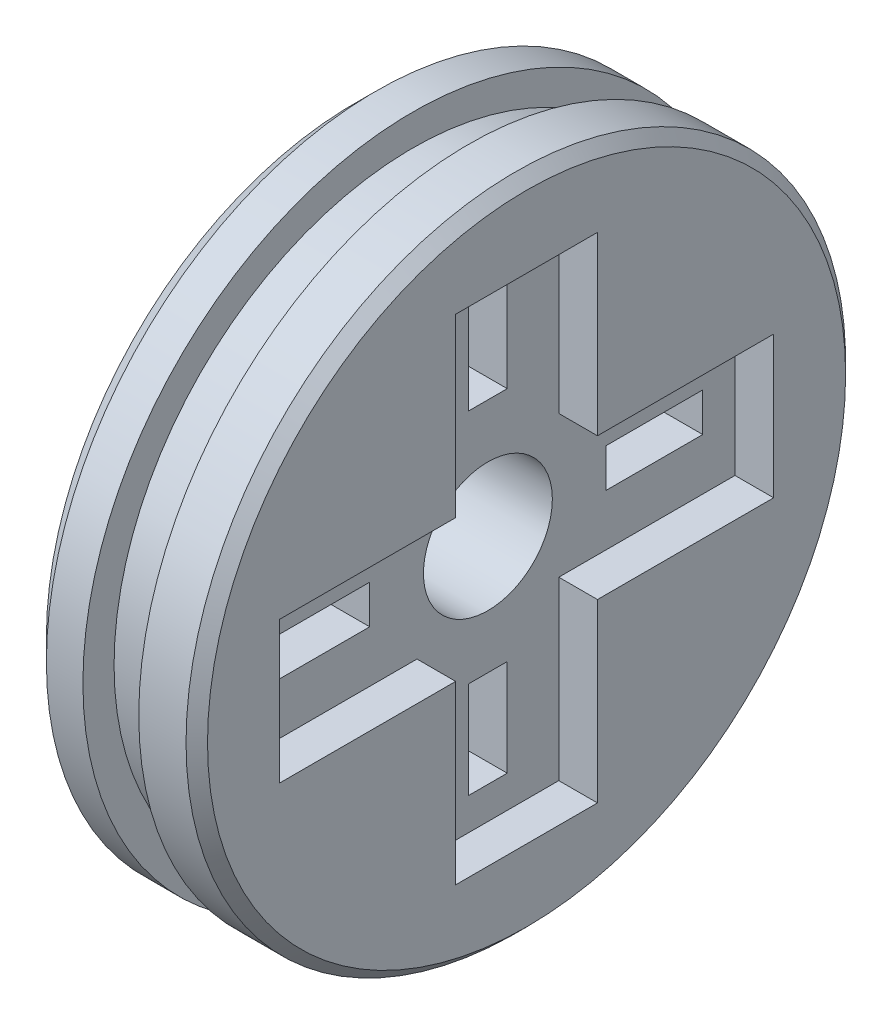
from build123d import *

# Parameters (mm, degrees)
SKETCH2_W            = 2.6
SKETCH2_H            = 2.45
BOSS_EXTRUDE1_START  = 62.7
SKETCH3_W            = 2.3
SKETCH3_H            = 23
BOSS_EXTRUDE1_DEPTH  = 6.6
BOSS_EXTRUDE2_START  = 54.5
SKETCH4_W            = 2.3
SKETCH4_H            = 6.6
BOSS_EXTRUDE2_DEPTH  = 23
BOSS_EXTRUDE3_START  = -79
SKETCH5_R            = 4.6
BOSS_EXTRUDE3_DEPTH  = 2.3
BOSS_EXTRUDE4_START  = -85.7
SKETCH6_R            = 7.1
BOSS_EXTRUDE4_DEPTH  = 1.7
BOSS_EXTRUDE5_START  = -84.1
SKETCH7_R            = 3
BOSS_EXTRUDE5_DEPTH  = 5.2
BOSS_EXTRUDE6_START  = 65.1
SKETCH8_W            = 4.1
SKETCH8_H            = 2.1
BOSS_EXTRUDE6_DEPTH  = 1.8
BOSS_EXTRUDE7_START  = 71.5
SKETCH9_W            = 4.1
SKETCH9_H            = 1.8
BOSS_EXTRUDE7_DEPTH  = 2.1
BOSS_EXTRUDE8_START  = 65.1
SKETCH10_W           = 4.1
SKETCH10_H           = 2.1
BOSS_EXTRUDE8_DEPTH  = 1.8
BOSS_EXTRUDE9_START  = 58.4
SKETCH11_W           = 4.1
SKETCH11_H           = 1.8
BOSS_EXTRUDE9_DEPTH  = 2.1
BOSS_EXTRUDE10_START = 65.1
SKETCH12_W           = 5.3
SKETCH12_H           = 2.4
BOSS_EXTRUDE10_DEPTH = 1.8
BOSS_EXTRUDE11_START = 73.6
SKETCH13_W           = 5.3
SKETCH13_H           = 1.8
BOSS_EXTRUDE11_DEPTH = 2.4
BOSS_EXTRUDE12_START = 65.1
SKETCH14_W           = 5.3
SKETCH14_H           = 2.4
BOSS_EXTRUDE12_DEPTH = 1.8
BOSS_EXTRUDE13_START = 56
SKETCH15_W           = 5.3
SKETCH15_H           = 1.8
BOSS_EXTRUDE13_DEPTH = 2.4


with BuildPart() as part:
    # Sketch1 → Revolve1 (revolve)
    with BuildSketch(Plane.XY.offset(66)):
        Polygon((-77.2, -65), (-85.2, -65), (-85.2, -50.65), (-84.2, -49.65), (-77.7, -49.65), (-77.2, -50.15), align=None)
    revolve(axis=Axis((-90.2, -65, 66), (1, 0, 0)))


with BuildPart() as body_2:
    # Sketch2 → Revolve2 (revolve)
    with BuildSketch(Plane.XY.offset(66)):
        with Locations((-81.2, -49.875)):
            Rectangle(SKETCH2_W, SKETCH2_H)
    revolve(axis=Axis((-87.5, -65, 66), (1, 0, 0)))


with BuildPart() as part_1:
    add(part.part)

    # Combine1: cut body 2
    add(body_2.part, mode=Mode.SUBTRACT)


with BuildPart() as body_2_2:
    # Sketch3 → Boss-Extrude1 (new body)
    with BuildSketch(Plane.XY.offset(BOSS_EXTRUDE1_START)):
        with Locations((-77.85, -65)):
            Rectangle(SKETCH3_W, SKETCH3_H)
    extrude(amount=BOSS_EXTRUDE1_DEPTH)


with BuildPart() as part_2:
    add(part_1.part)

    # Combine2: cut body 2 2
    add(body_2_2.part, mode=Mode.SUBTRACT)


with BuildPart() as body_2_3:
    # Sketch4 → Boss-Extrude2 (new body)
    with BuildSketch(Plane.XY.offset(BOSS_EXTRUDE2_START)):
        with Locations((-77.85, -65)):
            Rectangle(SKETCH4_W, SKETCH4_H)
    extrude(amount=BOSS_EXTRUDE2_DEPTH)


with BuildPart() as part_3:
    add(part_2.part)

    # Combine3: cut body 2 3
    add(body_2_3.part, mode=Mode.SUBTRACT)


with BuildPart() as body_2_4:
    # Sketch5 → Boss-Extrude3 (new body)
    with BuildSketch(Plane(origin=(0, 0, 0), x_dir=(0, 0, -1), z_dir=(1, 0, 0)).offset(BOSS_EXTRUDE3_START)):
        with Locations((-66, -65)):
            Circle(SKETCH5_R)
    extrude(amount=BOSS_EXTRUDE3_DEPTH)


with BuildPart() as part_4:
    add(part_3.part)

    # Combine4: cut body 2 4
    add(body_2_4.part, mode=Mode.SUBTRACT)


with BuildPart() as body_2_5:
    # Sketch6 → Boss-Extrude4 (new body)
    with BuildSketch(Plane(origin=(0, 0, 0), x_dir=(0, 0, -1), z_dir=(1, 0, 0)).offset(BOSS_EXTRUDE4_START)):
        with Locations((-66, -65)):
            Circle(SKETCH6_R)
    extrude(amount=BOSS_EXTRUDE4_DEPTH)


with BuildPart() as part_5:
    add(part_4.part)

    # Combine5: cut body 2 5
    add(body_2_5.part, mode=Mode.SUBTRACT)


with BuildPart() as body_2_6:
    # Sketch7 → Boss-Extrude5 (new body)
    with BuildSketch(Plane(origin=(0, 0, 0), x_dir=(0, 0, -1), z_dir=(1, 0, 0)).offset(BOSS_EXTRUDE5_START)):
        with Locations((-66, -65)):
            Circle(SKETCH7_R)
    extrude(amount=BOSS_EXTRUDE5_DEPTH)


with BuildPart() as part_6:
    add(part_5.part)

    # Combine6: cut body 2 6
    add(body_2_6.part, mode=Mode.SUBTRACT)


with BuildPart() as body_2_7:
    # Sketch8 → Boss-Extrude6 (new body)
    with BuildSketch(Plane.XY.offset(BOSS_EXTRUDE6_START)):
        with Locations((-80.95, -58.45)):
            Rectangle(SKETCH8_W, SKETCH8_H)
    extrude(amount=BOSS_EXTRUDE6_DEPTH)


with BuildPart() as part_7:
    add(part_6.part)

    # Combine7: cut body 2 7
    add(body_2_7.part, mode=Mode.SUBTRACT)


with BuildPart() as body_2_8:
    # Sketch9 → Boss-Extrude7 (new body)
    with BuildSketch(Plane.XY.offset(BOSS_EXTRUDE7_START)):
        with Locations((-80.95, -65)):
            Rectangle(SKETCH9_W, SKETCH9_H)
    extrude(amount=BOSS_EXTRUDE7_DEPTH)


with BuildPart() as part_8:
    add(part_7.part)

    # Combine8: cut body 2 8
    add(body_2_8.part, mode=Mode.SUBTRACT)


with BuildPart() as body_2_9:
    # Sketch10 → Boss-Extrude8 (new body)
    with BuildSketch(Plane.XY.offset(BOSS_EXTRUDE8_START)):
        with Locations((-80.95, -71.55)):
            Rectangle(SKETCH10_W, SKETCH10_H)
    extrude(amount=BOSS_EXTRUDE8_DEPTH)


with BuildPart() as part_9:
    add(part_8.part)

    # Combine9: cut body 2 9
    add(body_2_9.part, mode=Mode.SUBTRACT)


with BuildPart() as body_2_10:
    # Sketch11 → Boss-Extrude9 (new body)
    with BuildSketch(Plane.XY.offset(BOSS_EXTRUDE9_START)):
        with Locations((-80.95, -65)):
            Rectangle(SKETCH11_W, SKETCH11_H)
    extrude(amount=BOSS_EXTRUDE9_DEPTH)


with BuildPart() as part_10:
    add(part_9.part)

    # Combine10: cut body 2 10
    add(body_2_10.part, mode=Mode.SUBTRACT)


with BuildPart() as body_2_11:
    # Sketch12 → Boss-Extrude10 (new body)
    with BuildSketch(Plane.XY.offset(BOSS_EXTRUDE10_START)):
        with Locations((-81.55, -56.2)):
            Rectangle(SKETCH12_W, SKETCH12_H)
    extrude(amount=BOSS_EXTRUDE10_DEPTH)


with BuildPart() as part_11:
    add(part_10.part)

    # Combine11: cut body 2 11
    add(body_2_11.part, mode=Mode.SUBTRACT)


with BuildPart() as body_2_12:
    # Sketch13 → Boss-Extrude11 (new body)
    with BuildSketch(Plane.XY.offset(BOSS_EXTRUDE11_START)):
        with Locations((-81.55, -65)):
            Rectangle(SKETCH13_W, SKETCH13_H)
    extrude(amount=BOSS_EXTRUDE11_DEPTH)


with BuildPart() as part_12:
    add(part_11.part)

    # Combine12: cut body 2 12
    add(body_2_12.part, mode=Mode.SUBTRACT)


with BuildPart() as body_2_13:
    # Sketch14 → Boss-Extrude12 (new body)
    with BuildSketch(Plane.XY.offset(BOSS_EXTRUDE12_START)):
        with Locations((-81.55, -73.8)):
            Rectangle(SKETCH14_W, SKETCH14_H)
    extrude(amount=BOSS_EXTRUDE12_DEPTH)


with BuildPart() as part_13:
    add(part_12.part)

    # Combine13: cut body 2 13
    add(body_2_13.part, mode=Mode.SUBTRACT)


with BuildPart() as body_2_14:
    # Sketch15 → Boss-Extrude13 (new body)
    with BuildSketch(Plane.XY.offset(BOSS_EXTRUDE13_START)):
        with Locations((-81.55, -65)):
            Rectangle(SKETCH15_W, SKETCH15_H)
    extrude(amount=BOSS_EXTRUDE13_DEPTH)


with BuildPart() as part_14:
    add(part_13.part)

    # Combine14: cut body 2 14
    add(body_2_14.part, mode=Mode.SUBTRACT)


solid = part_14.part
